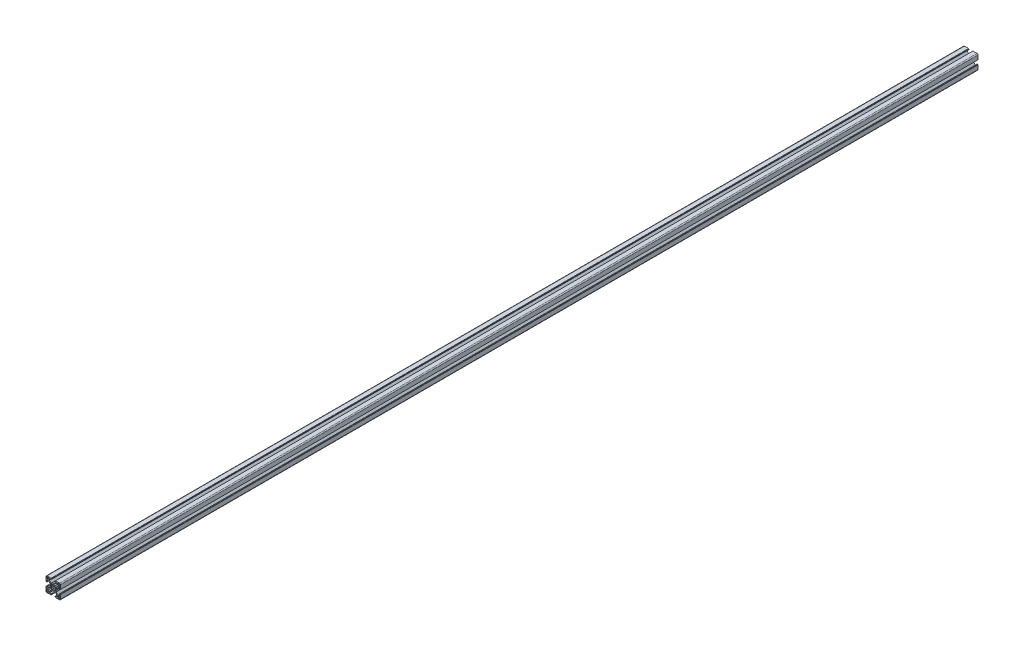
from build123d import *

# Parameters (mm, degrees)
BOSS_EXTRUDE1_DEPTH = 950
CIRPATTERN1_COUNT   = 4


with BuildPart() as part:
    # Sketch3 → Boss-Extrude1 (new, symmetric)
    with BuildSketch(Plane.XY):
        with BuildLine():
            Line((-4.503841895, 3.156803476), (-3.14772708, 1.530298739))
            ThreePointArc((-3.14772708, 1.530298739), (-3.410794979, 0.785160882), (-3.5, 0))
            Line((-3.5, 0), (-5.5, 0))
            Line((-5.5, 0), (-6, 0.866025404))
            Line((-6, 0.866025404), (-6, 3.996841995))
            ThreePointArc((-6, 3.996841995), (-6.038060234, 4.188183711), (-6.146446609, 4.350395385))
            Line((-6.146446609, 4.350395385), (-9.917104615, 8.121053391))
            ThreePointArc((-9.917104615, 8.121053391), (-10.079316289, 8.229439766), (-10.270658005, 8.2675))
            Line((-10.270658005, 8.2675), (-12.29, 8.2675))
            ThreePointArc((-12.29, 8.2675), (-12.643553391, 8.121053391), (-12.79, 7.7675))
            Line((-12.79, 7.7675), (-12.79, 4.5))
            ThreePointArc((-12.79, 4.5), (-12.936446609, 4.146446609), (-13.29, 4))
            Line((-13.29, 4), (-14.5, 4))
            Line((-14.5, 4), (-14.5, 4.5))
            Line((-14.5, 4.5), (-15, 4.5))
            Line((-15, 4.5), (-15, 12.968))
            ThreePointArc((-15, 12.968), (-14.404840979, 14.404840979), (-12.968, 15))
            Line((-12.968, 15), (-4.5, 15))
            Line((-4.5, 15), (-4.5, 14.5))
            Line((-4.5, 14.5), (-4, 14.5))
            Line((-4, 14.5), (-4, 13.29))
            ThreePointArc((-4, 13.29), (-4.146446609, 12.936446609), (-4.5, 12.79))
            Line((-4.5, 12.79), (-7.7675, 12.79))
            ThreePointArc((-7.7675, 12.79), (-8.121053391, 12.643553391), (-8.2675, 12.29))
            Line((-8.2675, 12.29), (-8.2675, 10.270658005))
            ThreePointArc((-8.2675, 10.270658005), (-8.229439766, 10.079316289), (-8.121053391, 9.917104615))
            Line((-8.121053391, 9.917104615), (-4.350395385, 6.146446609))
            ThreePointArc((-4.350395385, 6.146446609), (-4.188183711, 6.038060234), (-3.996841995, 6))
            Line((-3.996841995, 6), (-0.866025404, 6))
            Line((-0.866025404, 6), (0, 5.5))
            Line((0, 5.5), (0, 3.5))
            ThreePointArc((0, 3.5), (-0.785160882, 3.410794979), (-1.530298739, 3.14772708))
            Line((-1.530298739, 3.14772708), (-3.156803476, 4.503841895))
            ThreePointArc((-3.156803476, 4.503841895), (-3.889087297, 3.889087297), (-4.503841895, 3.156803476))
        make_face()
        with BuildLine():
            Line((-12.705, 9.5135), (-10.5135, 9.5135))
            ThreePointArc((-10.5135, 9.5135), (-9.806393219, 9.806393219), (-9.5135, 10.5135))
            Line((-9.5135, 10.5135), (-9.5135, 12.705))
            ThreePointArc((-9.5135, 12.705), (-9.806393219, 13.412106781), (-10.5135, 13.705))
            Line((-10.5135, 13.705), (-12.705, 13.705))
            ThreePointArc((-12.705, 13.705), (-13.412106781, 13.412106781), (-13.705, 12.705))
            Line((-13.705, 12.705), (-13.705, 10.5135))
            ThreePointArc((-13.705, 10.5135), (-13.412106781, 9.806393219), (-12.705, 9.5135))
        make_face(mode=Mode.SUBTRACT)
    boss_extrude1 = extrude(amount=BOSS_EXTRUDE1_DEPTH, both=True)

    # CirPattern1: Boss-Extrude1 ×4 about axis
    cirpattern1_axis = Axis((0, 0, 76.2), (0, 0, -1))
    for i in range(1, CIRPATTERN1_COUNT):
        add(boss_extrude1.rotate(cirpattern1_axis, i * 360 / CIRPATTERN1_COUNT))


solid = part.part
